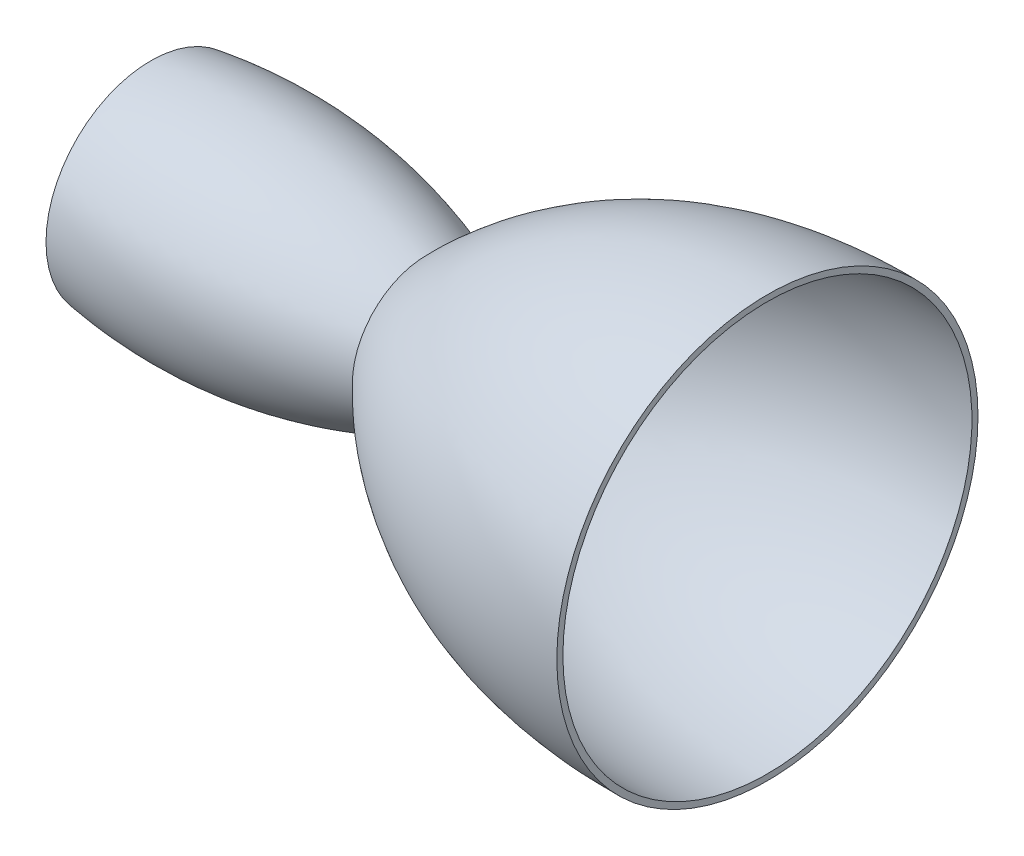
from build123d import *


with BuildPart() as part:
    # Sketch1 → Revolve3 (revolve)
    with BuildSketch(Plane.XY):
        with BuildLine():
            Line((500, 300), (500, 308.89))
            add(Edge.make_bspline(
                [(0, 108.89), (195.638395149, 311.889133265), (500, 308.89)],
                knots=[0, 0, 0, 1, 1, 1], degree=2))
            add(Edge.make_bspline(
                [(0, 108.89), (-196.731010959, 185.043112788), (-404.496825295, 153.699870936)],
                knots=[0, 0, 0, 1, 1, 1], degree=2))
            Line((-404.496825295, 153.699870936), (-404.496825295, 144.809870936))
            add(Edge.make_bspline(
                [(0, 100), (-196.731010959, 176.153112788), (-404.496825295, 144.809870936)],
                knots=[0, 0, 0, 1, 1, 1], degree=2))
            add(Edge.make_bspline(
                [(0, 100), (195.638395149, 302.999133265), (500, 300)],
                knots=[0, 0, 0, 1, 1, 1], degree=2))
        make_face()
    revolve(axis=Axis((-1229.828239288, 0, 0), (1, 0, 0)))


solid = part.part
